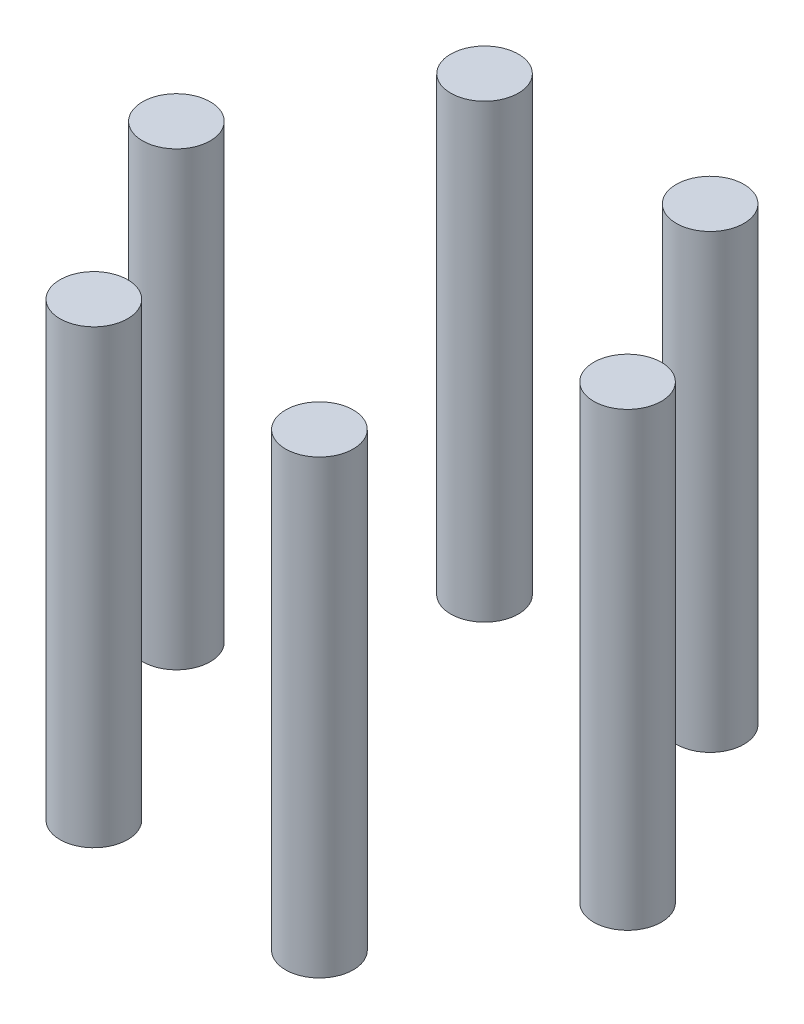
from build123d import *

# Parameters (mm, degrees)
BOSS_EXTRUDE1_DEPTH        = 14
BOSS_EXTRUDE1_DEPTH_BACK   = 6
SKETCH2_R                  = 1.5
BOSS_EXTRUDE1_2_DEPTH      = 14
BOSS_EXTRUDE1_2_DEPTH_BACK = 6
BOSS_EXTRUDE1_3_DEPTH      = 14
BOSS_EXTRUDE1_3_DEPTH_BACK = 6
BOSS_EXTRUDE1_4_DEPTH      = 14
BOSS_EXTRUDE1_4_DEPTH_BACK = 6
BOSS_EXTRUDE1_5_DEPTH      = 14
BOSS_EXTRUDE1_5_DEPTH_BACK = 6
BOSS_EXTRUDE1_6_DEPTH      = 14
BOSS_EXTRUDE1_6_DEPTH_BACK = 6


with BuildPart() as part:
    # Sketch2 → Boss-Extrude1 (new, two sides: drawn at the far end of the back side and taken through both)
    with BuildSketch(Plane(origin=(0, 0, 0), x_dir=(1, 0, 0), z_dir=(0, 1, 0)).offset(-BOSS_EXTRUDE1_DEPTH_BACK)):
        with Locations((9.5, 0)):
            Circle(SKETCH2_R)
    extrude(amount=BOSS_EXTRUDE1_DEPTH + BOSS_EXTRUDE1_DEPTH_BACK)


with BuildPart() as body_2:
    # Sketch2 → Boss-Extrude1 2 (new, two sides: drawn at the far end of the back side and taken through both)
    with BuildSketch(Plane(origin=(0, 0, 0), x_dir=(1, 0, 0), z_dir=(0, 1, 0)).offset(-BOSS_EXTRUDE1_2_DEPTH_BACK)):
        with Locations((4.5, -8.660254038)):
            Circle(SKETCH2_R)
    extrude(amount=BOSS_EXTRUDE1_2_DEPTH + BOSS_EXTRUDE1_2_DEPTH_BACK)


with BuildPart() as body_3:
    # Sketch2 → Boss-Extrude1 3 (new, two sides: drawn at the far end of the back side and taken through both)
    with BuildSketch(Plane(origin=(0, 0, 0), x_dir=(1, 0, 0), z_dir=(0, 1, 0)).offset(-BOSS_EXTRUDE1_3_DEPTH_BACK)):
        with Locations((-5.5, -8.660254038)):
            Circle(SKETCH2_R)
    extrude(amount=BOSS_EXTRUDE1_3_DEPTH + BOSS_EXTRUDE1_3_DEPTH_BACK)


with BuildPart() as body_4:
    # Sketch2 → Boss-Extrude1 4 (new, two sides: drawn at the far end of the back side and taken through both)
    with BuildSketch(Plane(origin=(0, 0, 0), x_dir=(1, 0, 0), z_dir=(0, 1, 0)).offset(-BOSS_EXTRUDE1_4_DEPTH_BACK)):
        with Locations((-10.5, 0)):
            Circle(SKETCH2_R)
    extrude(amount=BOSS_EXTRUDE1_4_DEPTH + BOSS_EXTRUDE1_4_DEPTH_BACK)


with BuildPart() as body_5:
    # Sketch2 → Boss-Extrude1 5 (new, two sides: drawn at the far end of the back side and taken through both)
    with BuildSketch(Plane(origin=(0, 0, 0), x_dir=(1, 0, 0), z_dir=(0, 1, 0)).offset(-BOSS_EXTRUDE1_5_DEPTH_BACK)):
        with Locations((-5.5, 8.660254038)):
            Circle(SKETCH2_R)
    extrude(amount=BOSS_EXTRUDE1_5_DEPTH + BOSS_EXTRUDE1_5_DEPTH_BACK)


with BuildPart() as body_6:
    # Sketch2 → Boss-Extrude1 6 (new, two sides: drawn at the far end of the back side and taken through both)
    with BuildSketch(Plane(origin=(0, 0, 0), x_dir=(1, 0, 0), z_dir=(0, 1, 0)).offset(-BOSS_EXTRUDE1_6_DEPTH_BACK)):
        with Locations((4.5, 8.660254038)):
            Circle(SKETCH2_R)
    extrude(amount=BOSS_EXTRUDE1_6_DEPTH + BOSS_EXTRUDE1_6_DEPTH_BACK)


solid = Compound([part.part, body_2.part, body_3.part, body_4.part, body_5.part, body_6.part])
